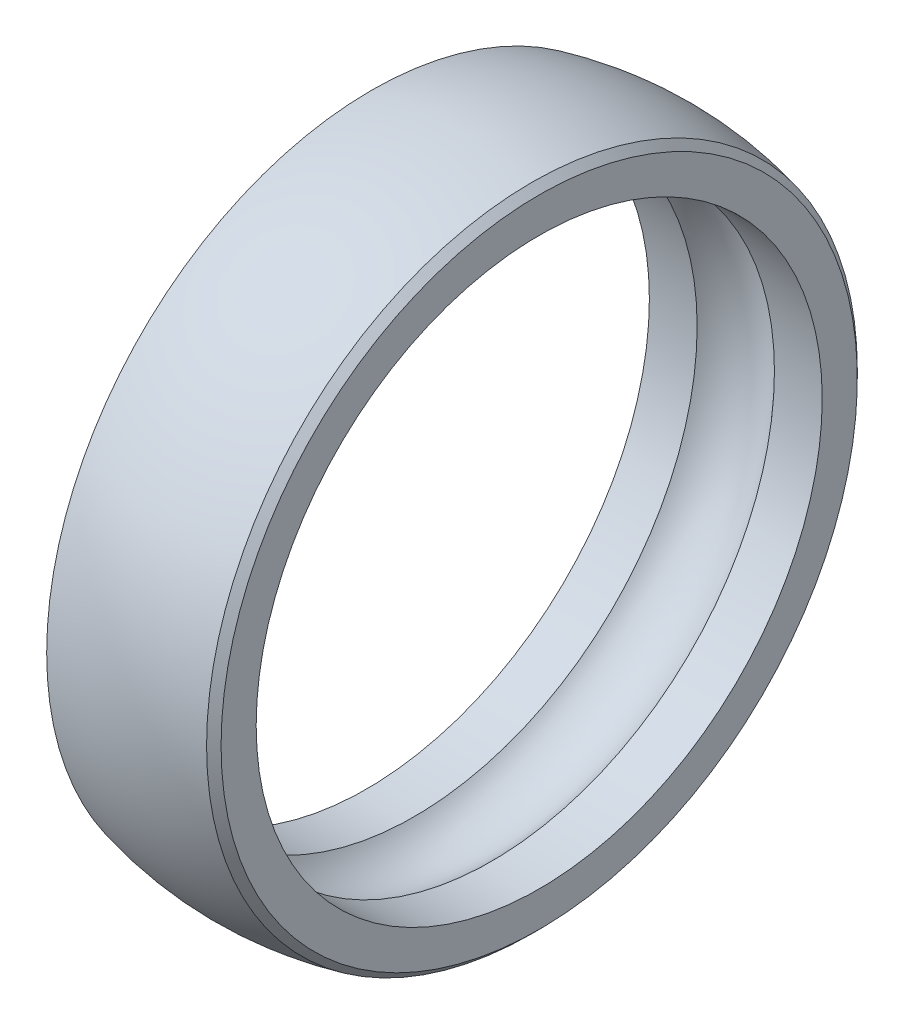
from build123d import *

# Parameters (mm, degrees)
CHANFREIN1_SIZE   = 0.5
CHANFREIN1_SIZE_2 = 0.706151684


with BuildPart() as part:
    # Esquisse1 → Base-Révolution (revolve)
    with BuildSketch(Plane(origin=(0, 0, 0), x_dir=(1, 0, 0), z_dir=(0, 1, 0)), mode=Mode.PRIVATE) as base_r_volution_sk:
        with BuildLine():
            Line((0, 30), (0, 26.2))
            Line((0, 26.2), (4.422291236, 26.2))
            ThreePointArc((4.422291236, 26.2), (8, 27.8), (11.577708764, 26.2))
            Line((11.577708764, 26.2), (16, 26.2))
            Line((16, 26.2), (16, 30))
            ThreePointArc((16, 30), (15.707106781, 30.707106781), (15, 31))
            Line((15, 31), (1, 31))
            ThreePointArc((1, 31), (0.292893219, 30.707106781), (0, 30))
        make_face()
    revolve(base_r_volution_sk.sketch.rotate(Axis((0, 0, 0), (1, 0, 0)), 180), axis=Axis((0, 0, 0), (1, 0, 0)))

    # Esquisse2 → Enlèvement de matière-Révolution1 (revolve, cut)
    with BuildSketch(Plane.XY):
        with BuildLine():
            Line((0, 29.949958264), (0, 39.553831479))
            Line((0, 39.553831479), (16, 39.553831479))
            Line((16, 39.553831479), (16, 29.949958264))
            ThreePointArc((16, 29.949958264), (8, 31), (0, 29.949958264))
        make_face()
    revolve(axis=Axis((0, 0, 0), (1, 0, 0)), mode=Mode.SUBTRACT)

    # Chanfrein1
    # the kernel refuses this chamfer: 0.706151684, 0.5 mm, written as the material it takes off along each edge
    with BuildSketch(Plane(origin=(16, 0, 0), x_dir=(0, 1, 0), z_dir=(0, 0, -1))) as chanfrein1_piece_1:
        with BuildLine():
            Line((29.949958264 - CHANFREIN1_SIZE, 0), (30.121257319, -0.671299055))
            ThreePointArc((30.121257319, -0.671299055), (30.040483401, -0.34693806), (29.949958264, 0))
            Line((29.949958264, 0), (29.949958264 - CHANFREIN1_SIZE, 0))
        make_face()
    revolve(axis=Axis((16, 0, 0), (1, 0, 0)), mode=Mode.SUBTRACT)
    with BuildSketch(Plane(origin=(0, 0, 0), x_dir=(0, 1, 0), z_dir=(0, 0, -1))) as chanfrein1_piece_2:
        with BuildLine():
            Line((29.949958264 - CHANFREIN1_SIZE_2, 0), (30.074132004, 0.480253714))
            ThreePointArc((30.074132004, 0.480253714), (30.015483294, 0.249466944), (29.949958264, 0))
            Line((29.949958264, 0), (29.949958264 - CHANFREIN1_SIZE_2, 0))
        make_face()
    revolve(axis=Axis((0, 0, 0), (1, 0, 0)), mode=Mode.SUBTRACT)


solid = part.part
